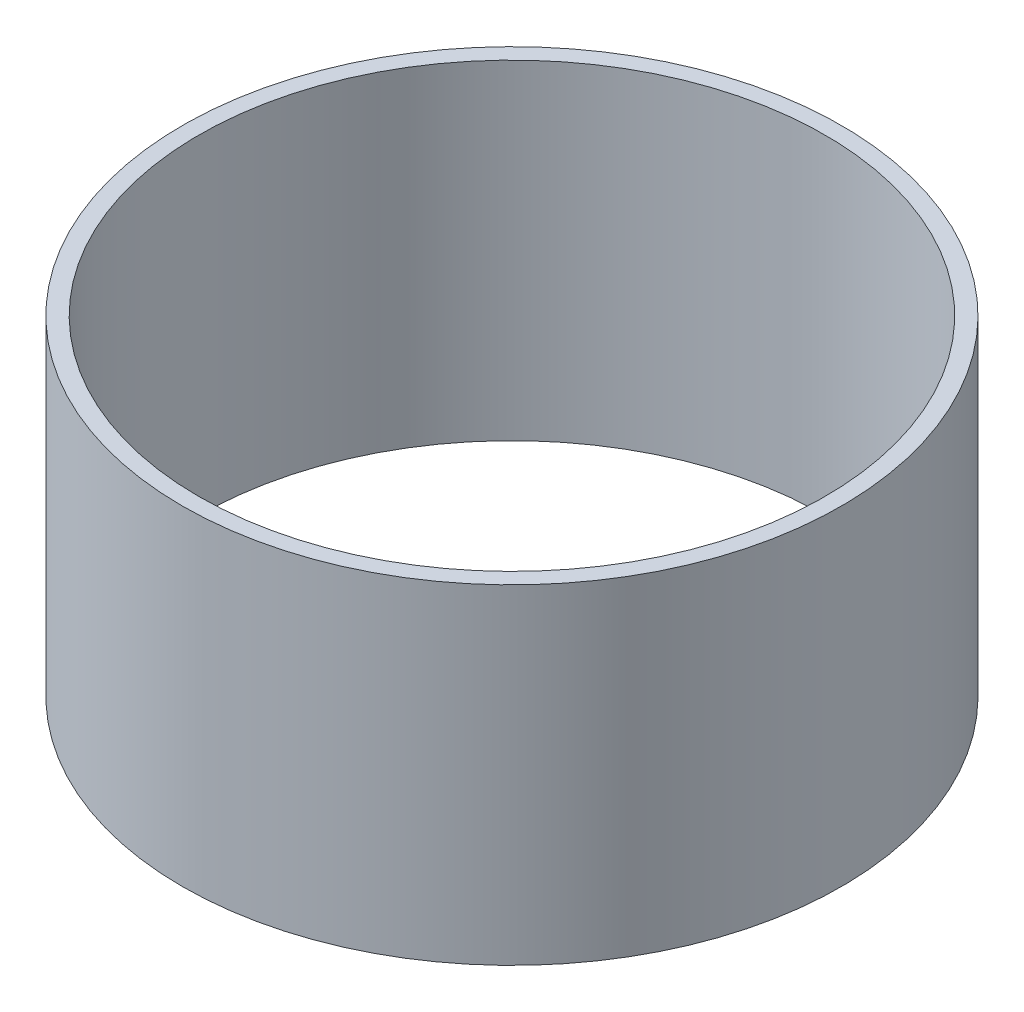
from build123d import *

# Parameters (mm, degrees)
SKETCH1_R           = 100
SKETCH1_R_2         = 95
BOSS_EXTRUDE1_DEPTH = 100


with BuildPart() as part:
    # Sketch1 → Boss-Extrude1 (new body)
    with BuildSketch(Plane(origin=(0, 0, 0), x_dir=(1, 0, 0), z_dir=(0, 1, 0))):
        Circle(SKETCH1_R)
        Circle(SKETCH1_R_2, mode=Mode.SUBTRACT)
    extrude(amount=BOSS_EXTRUDE1_DEPTH)


solid = part.part
